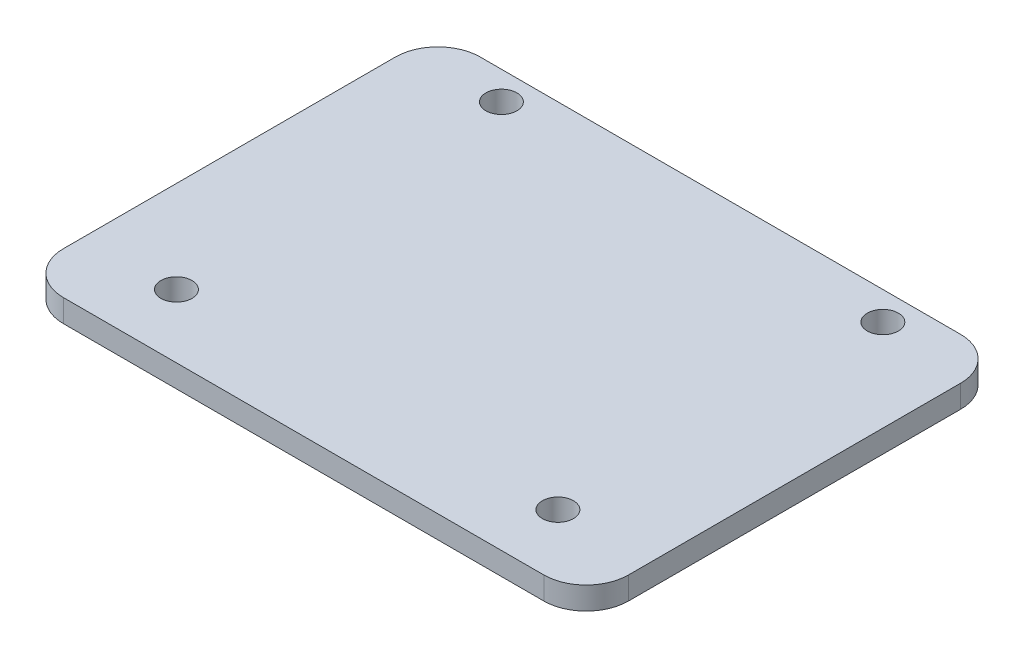
from build123d import *

# Parameters (mm, degrees)
SKETCH1_W                = 40
SKETCH1_H                = 29.5
BOSS_EXTRUDE1_DEPTH      = 1.6
M2_CLEARANCE_HOLE1_D     = 2.2
M2_CLEARANCE_HOLE1_DEPTH = 5.2
M2_CLEARANCE_HOLE1_TIP   = 0.660946681
FILLET1_R                = 3


with BuildPart() as part:
    # Sketch1 → Boss-Extrude1 (new body)
    with BuildSketch(Plane(origin=(0, 0, 0), x_dir=(1, 0, 0), z_dir=(0, 1, 0))):
        Rectangle(SKETCH1_W, SKETCH1_H)
    extrude(amount=BOSS_EXTRUDE1_DEPTH)

    # M2 Clearance Hole1
    with Locations(Plane(origin=(0, 1.6, 0), x_dir=(1, 0, 0), z_dir=(0, 1, 0))):
        with Locations((-13.5, 12.75), (13.5, 12.75), (13.5, -10.25), (-13.5, -10.25)):
            Hole(M2_CLEARANCE_HOLE1_D / 2, depth=M2_CLEARANCE_HOLE1_DEPTH)
            with Locations((0, 0, -(M2_CLEARANCE_HOLE1_DEPTH + M2_CLEARANCE_HOLE1_TIP / 2))):  # 118° drill point
                Cone(0, M2_CLEARANCE_HOLE1_D / 2, M2_CLEARANCE_HOLE1_TIP, mode=Mode.SUBTRACT)

    # Fillet1
    fillet1_edges = [part.edges().sort_by_distance(p)[0] for p in [
        (20, 0.8, -14.75),
        (20, 0.8, 14.75),
        (-20, 0.8, 14.75),
        (-20, 0.8, -14.75),
    ]]
    fillet(fillet1_edges, radius=FILLET1_R)


solid = part.part
